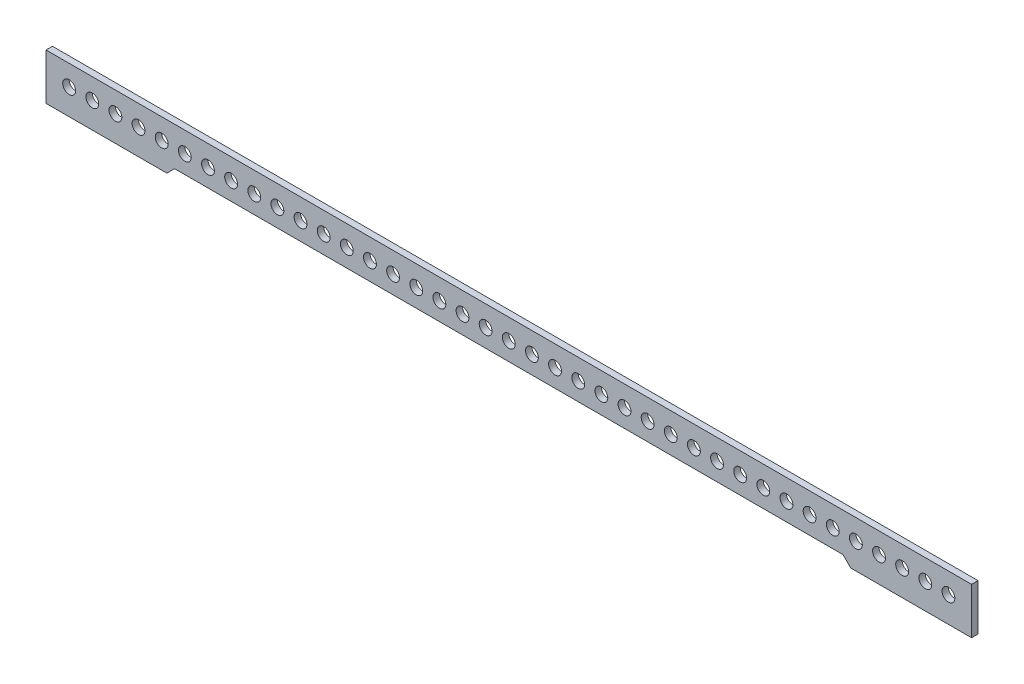
from build123d import *

# Parameters (mm, degrees)
BOSS_EXTRUDE1_DEPTH = 3.175
SKETCH3_R           = 3.175
CUT_EXTRUDE2_DEPTH  = 230.762094839


with BuildPart() as part:
    # Sketch1 → Boss-Extrude1 (new body)
    with BuildSketch(Plane.XY):
        Polygon((-228.6, 0), (228.6, 0), (228.6, -22.86), (168.91, -22.86), (165.1, -19.05), (-165.1, -19.05), (-168.91, -22.86), (-228.6, -22.86), align=None)
    extrude(amount=BOSS_EXTRUDE1_DEPTH)

    # Sketch3 → Cut-Extrude2 (cut, through all)
    with BuildSketch(Plane.XY.offset(3.175)):
        with Locations((-217.17, -10.16)):
            Circle(SKETCH3_R)
        with Locations((-205.74, -10.16)):
            Circle(SKETCH3_R)
        with Locations((-194.31, -10.16)):
            Circle(SKETCH3_R)
        with Locations((-182.88, -10.16)):
            Circle(SKETCH3_R)
        with Locations((-171.45, -10.16)):
            Circle(SKETCH3_R)
        with Locations((-160.02, -10.16)):
            Circle(SKETCH3_R)
        with Locations((-148.59, -10.16)):
            Circle(SKETCH3_R)
        with Locations((-137.16, -10.16)):
            Circle(SKETCH3_R)
        with Locations((-125.73, -10.16)):
            Circle(SKETCH3_R)
        with Locations((-114.3, -10.16)):
            Circle(SKETCH3_R)
        with Locations((-102.87, -10.16)):
            Circle(SKETCH3_R)
        with Locations((-91.44, -10.16)):
            Circle(SKETCH3_R)
        with Locations((-80.01, -10.16)):
            Circle(SKETCH3_R)
        with Locations((-68.58, -10.16)):
            Circle(SKETCH3_R)
        with Locations((-57.15, -10.16)):
            Circle(SKETCH3_R)
        with Locations((-45.72, -10.16)):
            Circle(SKETCH3_R)
        with Locations((-34.29, -10.16)):
            Circle(SKETCH3_R)
        with Locations((-22.86, -10.16)):
            Circle(SKETCH3_R)
        with Locations((-11.43, -10.16)):
            Circle(SKETCH3_R)
        with Locations((0, -10.16)):
            Circle(SKETCH3_R)
        with Locations((11.43, -10.16)):
            Circle(SKETCH3_R)
        with Locations((22.86, -10.16)):
            Circle(SKETCH3_R)
        with Locations((34.29, -10.16)):
            Circle(SKETCH3_R)
        with Locations((45.72, -10.16)):
            Circle(SKETCH3_R)
        with Locations((57.15, -10.16)):
            Circle(SKETCH3_R)
        with Locations((68.58, -10.16)):
            Circle(SKETCH3_R)
        with Locations((80.01, -10.16)):
            Circle(SKETCH3_R)
        with Locations((91.44, -10.16)):
            Circle(SKETCH3_R)
        with Locations((102.87, -10.16)):
            Circle(SKETCH3_R)
        with Locations((114.3, -10.16)):
            Circle(SKETCH3_R)
        with Locations((125.73, -10.16)):
            Circle(SKETCH3_R)
        with Locations((137.16, -10.16)):
            Circle(SKETCH3_R)
        with Locations((148.59, -10.16)):
            Circle(SKETCH3_R)
        with Locations((160.02, -10.16)):
            Circle(SKETCH3_R)
        with Locations((171.45, -10.16)):
            Circle(SKETCH3_R)
        with Locations((182.88, -10.16)):
            Circle(SKETCH3_R)
        with Locations((194.31, -10.16)):
            Circle(SKETCH3_R)
        with Locations((205.74, -10.16)):
            Circle(SKETCH3_R)
        with Locations((217.17, -10.16)):
            Circle(SKETCH3_R)
    extrude(amount=-CUT_EXTRUDE2_DEPTH, mode=Mode.SUBTRACT)


solid = part.part
